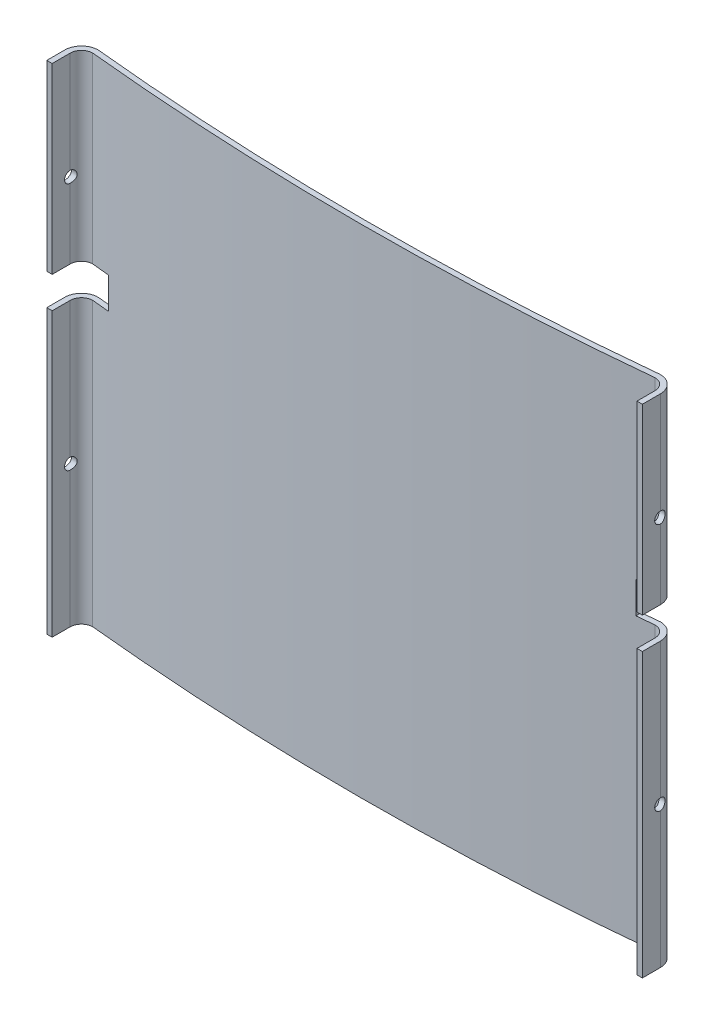
from build123d import *

# Parameters (mm, degrees)
THICKEN1_DEPTH     = 442
THICKEN1_2_DEPTH   = 251.51
THICKEN1_START     = 279.51
THICKEN1_3_DEPTH   = 162.49
SKETCH4_R          = 5
CUT_EXTRUDE1_DEPTH = 20
SKETCH5_R          = 5
CUT_EXTRUDE2_DEPTH = 20
CUT_EXTRUDE3_START = -20
SKETCH7_R          = 5
CUT_EXTRUDE3_DEPTH = 20


# Read off the part's stored shape, not the designer's step: Thicken1
with BuildPart() as part:
    # Thicken1 outline → Thicken1 (new body)
    with BuildSketch(Plane(origin=(0, 0, 0), x_dir=(1, 0, 0), z_dir=(0, 1, 0))):
        with BuildLine():
            ThreePointArc((-234.724558603, 8.605268641), (0, -2.4), (234.724558603, 8.605268641))
            Line((234.724558603, 8.605268641), (234.275441397, 13.384211383))
            ThreePointArc((234.275441397, 13.384211383), (0, 2.4), (-234.275441397, 13.384211383))
            Line((-234.275441397, 13.384211383), (-234.724558603, 8.605268641))
        make_face()
    extrude(amount=THICKEN1_DEPTH)

    # Thicken1 2 outline → Thicken1 2 (add)
    with BuildSketch(Plane(origin=(0, 0, 0), x_dir=(1, 0, 0), z_dir=(0, 1, 0))):
        with BuildLine():
            Line((234.275441397, 13.384211383), (234.724558603, 8.605268641))
            ThreePointArc((234.724558603, 8.605268641), (242.420228217, 9.340459098), (250.113595715, 10.099361169))
            ThreePointArc((250.113595715, 10.099361169), (257.181828344, 7.101502773), (260.1, 0))
            Line((260.1, 0), (260.1, -16))
            Line((260.1, -16), (264.9, -16))
            Line((264.9, -16), (264.9, 0))
            ThreePointArc((264.9, 0), (260.491504347, 10.580091518), (249.874719929, 14.89947331))
            ThreePointArc((249.874719929, 14.89947331), (242.076266252, 14.129636973), (234.275441397, 13.384211383))
        make_face()
        with BuildLine():
            ThreePointArc((-250.113595715, 10.099361169), (-242.420228217, 9.340459098), (-234.724558603, 8.605268641))
            Line((-234.724558603, 8.605268641), (-234.275441397, 13.384211383))
            ThreePointArc((-234.275441397, 13.384211383), (-242.076266252, 14.129636973), (-249.874719929, 14.89947331))
            ThreePointArc((-249.874719929, 14.89947331), (-260.491504347, 10.580091518), (-264.9, 0))
            Line((-264.9, 0), (-264.9, -16))
            Line((-264.9, -16), (-260.1, -16))
            Line((-260.1, -16), (-260.1, 0))
            ThreePointArc((-260.1, 0), (-257.181828344, 7.101502773), (-250.113595715, 10.099361169))
        make_face()
    extrude(amount=THICKEN1_2_DEPTH)

    # Thicken1 3 outline → Thicken1 3 (add)
    with BuildSketch(Plane(origin=(0, 0, 0), x_dir=(1, 0, 0), z_dir=(0, 1, 0)).offset(THICKEN1_START)):
        with BuildLine():
            Line((234.275441397, 13.384211383), (234.724558603, 8.605268641))
            ThreePointArc((234.724558603, 8.605268641), (242.420228217, 9.340459098), (250.113595715, 10.099361169))
            ThreePointArc((250.113595715, 10.099361169), (257.181828344, 7.101502773), (260.1, 0))
            Line((260.1, 0), (260.1, -16))
            Line((260.1, -16), (264.9, -16))
            Line((264.9, -16), (264.9, 0))
            ThreePointArc((264.9, 0), (260.491504347, 10.580091518), (249.874719929, 14.89947331))
            ThreePointArc((249.874719929, 14.89947331), (242.076266252, 14.129636973), (234.275441397, 13.384211383))
        make_face()
        with BuildLine():
            ThreePointArc((-250.113595715, 10.099361169), (-242.420228217, 9.340459098), (-234.724558603, 8.605268641))
            Line((-234.724558603, 8.605268641), (-234.275441397, 13.384211383))
            ThreePointArc((-234.275441397, 13.384211383), (-242.076266252, 14.129636973), (-249.874719929, 14.89947331))
            ThreePointArc((-249.874719929, 14.89947331), (-260.491504347, 10.580091518), (-264.9, 0))
            Line((-264.9, 0), (-264.9, -16))
            Line((-264.9, -16), (-260.1, -16))
            Line((-260.1, -16), (-260.1, 0))
            ThreePointArc((-260.1, 0), (-257.181828344, 7.101502773), (-250.113595715, 10.099361169))
        make_face()
    extrude(amount=THICKEN1_3_DEPTH)

    # Sketch4 → Cut-Extrude1 (cut)
    with BuildSketch(Plane(origin=(250, 0, 0), x_dir=(0, 0, -1), z_dir=(1, 0, 0))):
        with Locations(Location((0, 346.755, 0), (0, 0, 90))):
            Circle(SKETCH4_R)
    extrude(amount=CUT_EXTRUDE1_DEPTH, mode=Mode.SUBTRACT)

    # Sketch5 → Cut-Extrude2 (cut)
    with BuildSketch(Plane(origin=(250, 0, 0), x_dir=(0, 0, -1), z_dir=(1, 0, 0))):
        with Locations(Location((0, 125.755, 0), (0, 0, 270))):
            Circle(SKETCH5_R)
    extrude(amount=CUT_EXTRUDE2_DEPTH, mode=Mode.SUBTRACT)

    # Sketch7 → Cut-Extrude3 (cut)
    with BuildSketch(Plane(origin=(-250, 0, 0), x_dir=(0, 0, -1), z_dir=(1, 0, 0)).offset(CUT_EXTRUDE3_START)):
        with Locations(Location((0, 346.755, 0), (0, 0, 90))):
            Circle(SKETCH7_R)
        with Locations(Location((0, 125.755, 0), (0, 0, 270))):
            Circle(SKETCH7_R)
    extrude(amount=CUT_EXTRUDE3_DEPTH, mode=Mode.SUBTRACT)


solid = part.part
